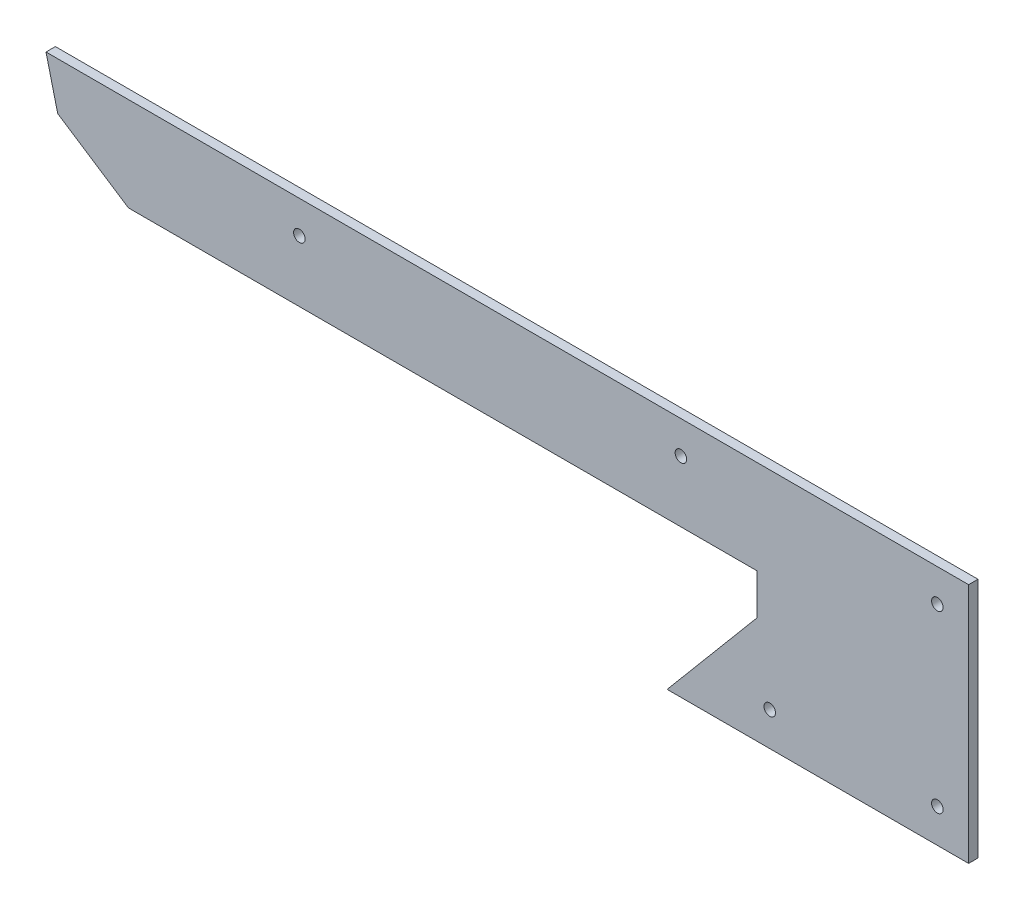
from build123d import *

# Parameters (mm, degrees)
IZIM1_R            = 9.25
TABAN_FLAN_1_DEPTH = 15


# Sheet-metal steps are written as plain solids
with BuildPart() as part:
    # Çizim1 → Taban-Flanş1 (new body)
    with BuildSketch(Plane.XY):
        Polygon((0, 0), (1475.066656138, 0), (1475.066656138, -386), (993.066656138, -386), (1136.84022729, -215.015424523), (1136.84022729, -150), (131.84022729, -150), (18.720629706, -76.015427794), align=None)
        with Locations((405.066656138, -52)):
            Circle(IZIM1_R, mode=Mode.SUBTRACT)
        with Locations((1015.066656138, -52)):
            Circle(IZIM1_R, mode=Mode.SUBTRACT)
        with Locations((1425.066656138, -52)):
            Circle(IZIM1_R, mode=Mode.SUBTRACT)
        with Locations((1425.066656138, -332)):
            Circle(IZIM1_R, mode=Mode.SUBTRACT)
        with Locations((1157.066656138, -332)):
            Circle(IZIM1_R, mode=Mode.SUBTRACT)
    extrude(amount=TABAN_FLAN_1_DEPTH)


solid = part.part
